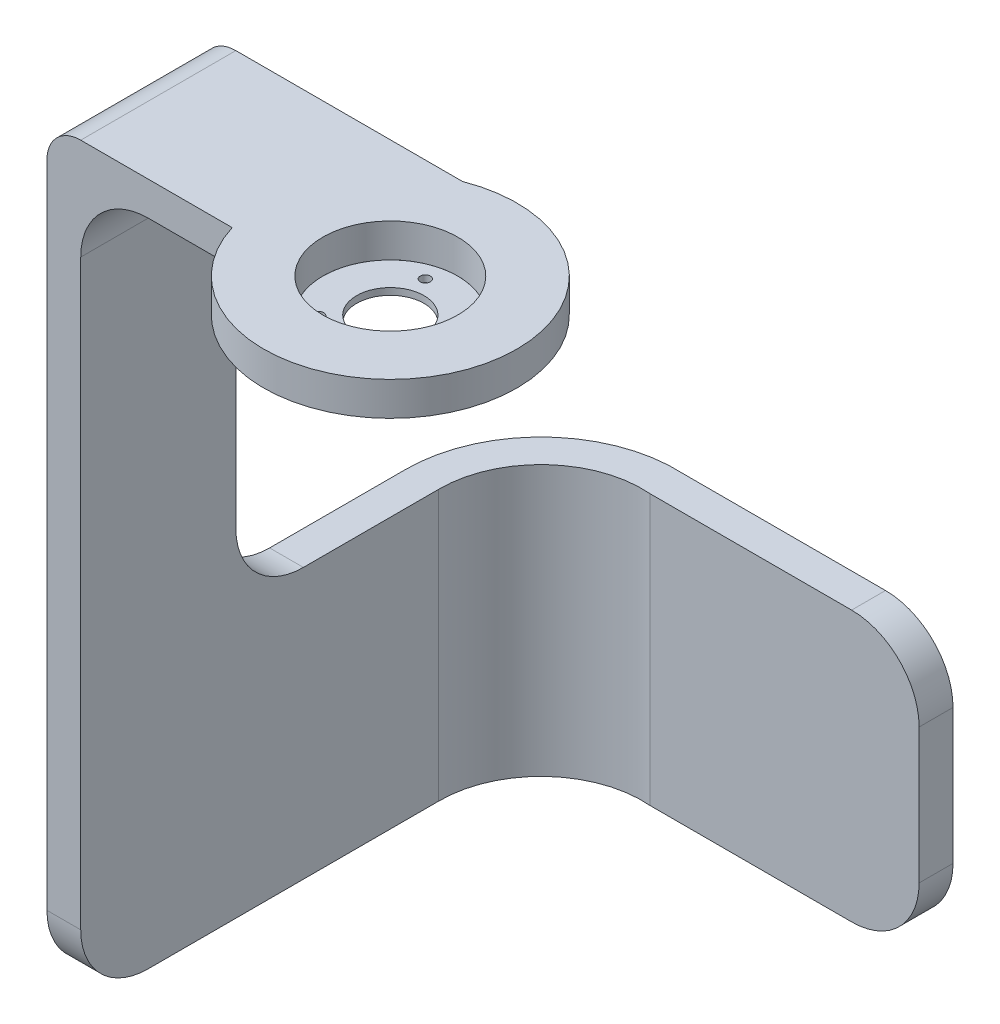
from build123d import *

# Parameters (mm, degrees)
ESQUISSE3_R                = 37.5
BOSS_EXTRU_1_DEPTH         = 10
ESQUISSE4_R                = 20
ENL_V_MAT_EXTRU_1_DEPTH    = 10
ESQUISSE7_W                = 45.949997051
ESQUISSE7_H                = 222.585817195
BOSS_EXTRU_2_DEPTH         = 10
CONG_1_R                   = 10
BOSS_EXTRU_3_DEPTH         = 80
CONG_2_R                   = 20
ENL_V_MAT_EXTRU_2_DEPTH    = 10
BOSS_EXTRU_4_START         = -10
BOSS_EXTRU_4_DEPTH         = 7
CONG_3_R                   = 5
R_P_TITION_LIN_AIRE1_COUNT = 2
R_P_TITION_LIN_AIRE1_PITCH = 20
CONG_4_R                   = 5
ESQUISSE14_R               = 20
BOSS_EXTRU_5_DEPTH         = 2
ESQUISSE17_R               = 9.978403452
ESQUISSE17_R_2             = 1.5
ENL_V_MAT_EXTRU_9_DEPTH    = 2


with BuildPart() as part:
    # Esquisse3 → Boss.-Extru.1 (new body)
    with BuildSketch(Plane(origin=(0, 0, 0), x_dir=(1, 0, 0), z_dir=(0, 1, 0))):
        with BuildLine():
            Line((-13.559611376, 34.962650634), (-80.71943609, 34.962650634))
            Line((-80.71943609, 34.962650634), (-80.71943609, -10.987346417))
            Line((-80.71943609, -10.987346417), (-35.854263606, -10.987346417))
            ThreePointArc((-35.854263606, -10.987346417), (-33.73845458, 16.36968792), (-13.559611376, 34.962650634))
        make_face()
        Circle(ESQUISSE3_R)
    extrude(amount=BOSS_EXTRU_1_DEPTH)

    # Esquisse4 → Enlèv. mat.-Extru.1 (cut)
    with BuildSketch(Plane(origin=(0, 10, 0), x_dir=(1, 0, 0), z_dir=(0, 1, 0))):
        with Locations(Location((0, 0, 0), (0, 0, 270))):
            Circle(ESQUISSE4_R)
    extrude(amount=-ENL_V_MAT_EXTRU_1_DEPTH, mode=Mode.SUBTRACT)

    # Esquisse7 → Boss.-Extru.2 (add)
    with BuildSketch(Plane.ZY.offset(80.71943609)):
        with Locations((-11.987652108, -101.292908598)):
            Rectangle(ESQUISSE7_W, ESQUISSE7_H)
    extrude(amount=BOSS_EXTRU_2_DEPTH)

    # Congé1
    cong_1_edges = [part.edges().sort_by_distance(p)[0] for p in [
        (-90.71943609, 10, -11.987652108),
    ]]
    fillet(cong_1_edges, radius=CONG_1_R)

    # Esquisse8 → Boss.-Extru.3 (add)
    with BuildSketch(Plane.XZ.offset(212.585817195)):
        with BuildLine():
            Line((-80.71943609, -34.962650634), (-80.71943609, -94.962650634))
            ThreePointArc((-80.71943609, -94.962650634), (-71.180307706, -117.262901723), (-48.268076901, -125.220655707))
            Line((-48.268076901, -125.220655707), (31.425291459, -125.220655707))
            Line((31.425291459, -125.220655707), (31.425291459, -135.263497175))
            Line((31.425291459, -135.263497175), (-48.574708541, -135.263497175))
            ThreePointArc((-48.574708541, -135.263497175), (-78.366180233, -124.230942217), (-90.719971648, -94.962650634))
            Line((-90.719971648, -94.962650634), (-90.719971648, -34.962650634))
            Line((-90.719971648, -34.962650634), (-80.71943609, -34.962650634))
        make_face()
    extrude(amount=-BOSS_EXTRU_3_DEPTH)

    # Congé2
    cong_2_edges = [part.edges().sort_by_distance(p)[0] for p in [
        (-85.71943609, -212.585817195, 10.987346417),
        (-85.71943609, -132.585817195, -34.962650634),
        (31.425291459, -132.585817195, -130.242076441),
        (31.425291459, -212.585817195, -130.242076441),
        (-80.71943609, 0, -11.987652108),
    ]]
    fillet(cong_2_edges, radius=CONG_2_R)

    # Esquisse9 → Enlèv. mat.-Extru.2 (cut)
    with BuildSketch(Plane(origin=(0, 0, -135.263497175), x_dir=(-1, 0, 0), z_dir=(0, 0, -1))):
        with BuildLine():
            Line((6.574708541, -170.087817995), (10.574708541, -170.087817995))
            ThreePointArc((10.574708541, -170.087817995), (8.574708541, -175.785817195), (6.574708541, -170.087817995))
        make_face()
    extrude(amount=-ENL_V_MAT_EXTRU_2_DEPTH, mode=Mode.SUBTRACT)

    # Esquisse13 → Boss.-Extru.4 (add)
    with BuildSketch(Plane.XY.offset(10.987346417).offset(BOSS_EXTRU_4_START)):
        Polygon((-90.71943609, -20), (-100.71943609, -20), (-100.71943609, -60), (-90.71943609, -60), (-90.71943609, -55), (-95.71943609, -55), (-95.71943609, -25), (-90.71943609, -25), align=None)
    boss_extru_4 = extrude(amount=-BOSS_EXTRU_4_DEPTH)

    # Congé3
    cong_3_edges = [part.edges().sort_by_distance(p)[0] for p in [
        (-95.71943609, -25, -2.512653583),
        (-95.71943609, -55, -2.512653583),
        (-90.71943609, -60, -2.512653583),
        (-90.71943609, -20, -2.512653583),
        (-100.71943609, -60, -2.512653583),
        (-100.71943609, -20, -2.512653583),
    ]]
    fillet(cong_3_edges, radius=CONG_3_R - 0.0001)  # a hair under: the kernel refuses the full size

    # Répétition linéaire1: Boss.-Extru.4 ×2
    with Locations(*[(0, 0, -i * R_P_TITION_LIN_AIRE1_PITCH) for i in range(1, R_P_TITION_LIN_AIRE1_COUNT)]):
        add(boss_extru_4)

    # Congé4
    cong_4_edges = [part.edges().sort_by_distance(p)[0] for p in [
        (-95.71943609, -55, -22.512653583),
        (-95.71943609, -25, -22.512653583),
        (-90.71943609, -20, -22.512653583),
        (-100.71943609, -20, -22.512653583),
        (-90.71943609, -60, -22.512653583),
        (-100.71943609, -60, -22.512653583),
    ]]
    fillet(cong_4_edges, radius=CONG_4_R - 0.0001)  # a hair under: the kernel refuses the full size


with BuildPart() as body_2:
    # Esquisse14 → Boss.-Extru.5 (new body)
    with BuildSketch(Plane.XZ):
        with Locations(Location((0, 0, 0), (0, 0, 270))):
            Circle(ESQUISSE14_R)
    extrude(amount=BOSS_EXTRU_5_DEPTH)

    # Esquisse17 → Enlèv. mat.-Extru.9 (cut)
    with BuildSketch(Plane.XZ.offset(2)):
        with Locations(Location((0, 0, 0), (0, 0, 270))):
            Circle(ESQUISSE17_R)
        with Locations(Location((14.540266373, 3.685193863, 0), (0, 0, 270))):
            Circle(ESQUISSE17_R_2)
        with Locations(Location((-10.461604689, 10.749643125, 0), (0, 0, 270))):
            Circle(ESQUISSE17_R_2)
        with Locations(Location((-4.078661683, -14.434836988, 0), (0, 0, 270))):
            Circle(ESQUISSE17_R_2)
    extrude(amount=-ENL_V_MAT_EXTRU_9_DEPTH, mode=Mode.SUBTRACT)


solid = Compound([part.part, body_2.part])
